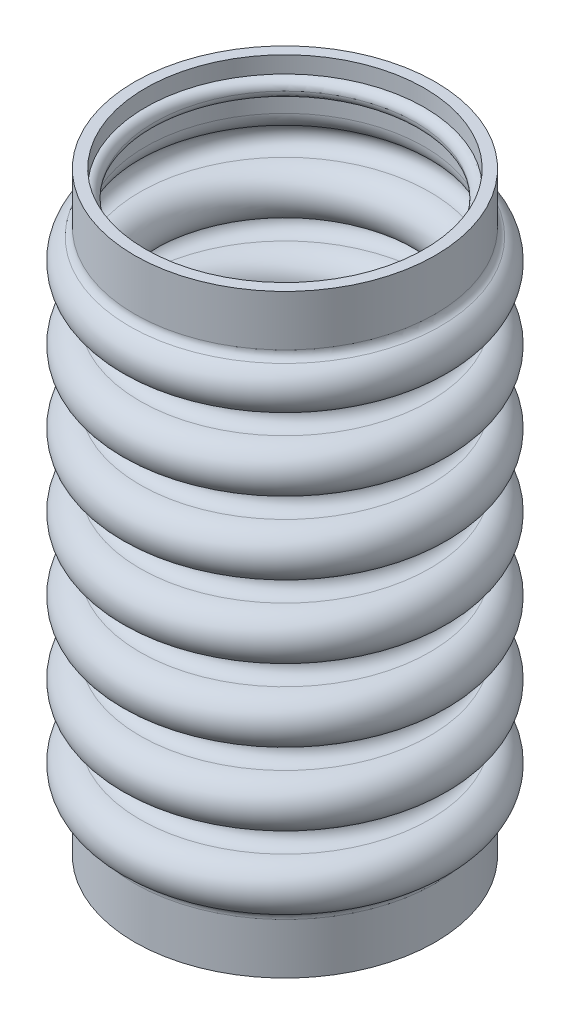
from build123d import *

# Parameters (mm, degrees)
CUT_EXTRUDE1_DEPTH      = 92.141803222
CUT_EXTRUDE1_DEPTH_BACK = 92.141803222
SKETCH3_W               = 41.5
SKETCH3_H               = 1.465119419
SKETCH3_H_2             = 1.466588033
SKETCH4_R               = 19.25
SKETCH4_R_2             = 18.05
BOSS_EXTRUDE2_DEPTH     = 1.2
FILLET2_R               = 1.2
FILLET2_OF_MIRROR3_R    = 1.2


with BuildPart() as part:
    # Sketch1 → Revolve1 (revolve)
    with BuildSketch(Plane.XY, mode=Mode.PRIVATE) as revolve1_sk:
        with BuildLine():
            Line((-20.75, 85), (-20.75, 76.534880581))
            ThreePointArc((-20.75, 76.534880581), (-20.938322032, 75.875077662), (-21.446543826, 75.414083425))
            ThreePointArc((-21.446543826, 75.414083425), (-23.171996107, 71.759160675), (-20.003436298, 69.250002525))
            ThreePointArc((-20.003436298, 69.250002525), (-18.25121849, 67.500521131), (-20.002401893, 65.750004325))
            ThreePointArc((-20.002401893, 65.750004325), (-23.254599463, 62.500739749), (-20.003879614, 59.250001201))
            ThreePointArc((-20.003879614, 59.250001201), (-18.25121857, 57.500741764), (-20.002401893, 55.750003301))
            ThreePointArc((-20.002401893, 55.750003301), (-23.254599463, 52.500738725), (-20.003879614, 49.250000177))
            ThreePointArc((-20.003879614, 49.250000177), (-18.25121857, 47.50074074), (-20.002401893, 45.750002276))
            ThreePointArc((-20.002401893, 45.750002276), (-23.254599463, 42.500737701), (-20.003879614, 39.249999153))
            ThreePointArc((-20.003879614, 39.249999153), (-18.25121857, 37.500739716), (-20.002401893, 35.750001252))
            ThreePointArc((-20.002401893, 35.750001252), (-23.254599463, 32.500736676), (-20.003879614, 29.249998128))
            ThreePointArc((-20.003879614, 29.249998128), (-18.25121857, 27.500738692), (-20.002401893, 25.750000228))
            ThreePointArc((-20.002401893, 25.750000228), (-23.254599463, 22.500735652), (-20.003879614, 19.249997104))
            ThreePointArc((-20.003879614, 19.249997104), (-18.25121857, 17.500737668), (-20.002401893, 15.749999204))
            ThreePointArc((-20.002401893, 15.749999204), (-23.168982395, 13.241064361), (-21.445722161, 9.586979071))
            ThreePointArc((-21.445722161, 9.586979071), (-20.938080206, 9.126001675), (-20.75, 8.466588033))
            Line((-20.75, 8.466588033), (-20.75, 0))
            Line((-20.75, 0), (-19.25, 0))
            Line((-19.25, 0), (-19.25, 8.466588033))
            ThreePointArc((-19.25, 8.466588033), (-19.663776453, 9.917298044), (-20.780588754, 10.931448316))
            ThreePointArc((-20.780588754, 10.931448316), (-21.708498111, 12.899032703), (-20.0034163, 14.249999547))
            ThreePointArc((-20.0034163, 14.249999547), (-16.751218498, 17.500737668), (-20.004894023, 20.749996499))
            ThreePointArc((-20.004894023, 20.749996499), (-21.754599941, 22.500735653), (-20.0034163, 24.250000571))
            ThreePointArc((-20.0034163, 24.250000571), (-16.751218498, 27.500738692), (-20.004894023, 30.749997523))
            ThreePointArc((-20.004894023, 30.749997523), (-21.754599941, 32.500736677), (-20.0034163, 34.250001595))
            ThreePointArc((-20.0034163, 34.250001595), (-16.751218498, 37.500739717), (-20.004894023, 40.749998548))
            ThreePointArc((-20.004894023, 40.749998548), (-21.754599941, 42.500737701), (-20.0034163, 44.250002619))
            ThreePointArc((-20.0034163, 44.250002619), (-16.751218498, 47.500740741), (-20.004894023, 50.749999572))
            ThreePointArc((-20.004894023, 50.749999572), (-21.754599941, 52.500738725), (-20.0034163, 54.250003644))
            ThreePointArc((-20.0034163, 54.250003644), (-16.751218498, 57.500741765), (-20.004894023, 60.750000596))
            ThreePointArc((-20.004894023, 60.750000596), (-21.754599941, 62.50073975), (-20.0034163, 64.250004668))
            ThreePointArc((-20.0034163, 64.250004668), (-16.751218556, 67.500964448), (-20.005337339, 70.75000132))
            ThreePointArc((-20.005337339, 70.75000132), (-21.711487516, 72.101088527), (-20.782396417, 74.069126839))
            ThreePointArc((-20.782396417, 74.069126839), (-19.664308469, 75.08331416), (-19.25, 76.534880581))
            Line((-19.25, 76.534880581), (-19.25, 85))
            Line((-19.25, 85), (-20.75, 85))
        make_face()
    revolve(revolve1_sk.sketch.rotate(Axis((0, 81.830959804, 0), (0, -1, 0)), 270), axis=Axis((0, 81.830959804, 0), (0, -1, 0)))

    # Sketch3 → Cut-Extrude1 (cut, two sides: drawn at the far end of the back side and taken through both)
    with BuildSketch(Plane(origin=(0, 0, 0), x_dir=(0, 0, -1), z_dir=(1, 0, 0)).offset(-CUT_EXTRUDE1_DEPTH_BACK)):
        with Locations((0, 84.267440291)):
            Rectangle(SKETCH3_W, SKETCH3_H)
        with Locations((0, 0.733294017)):
            Rectangle(SKETCH3_W, SKETCH3_H_2)
    extrude(amount=CUT_EXTRUDE1_DEPTH + CUT_EXTRUDE1_DEPTH_BACK, mode=Mode.SUBTRACT)

    # Sketch4 → Boss-Extrude2 (add, symmetric)
    with BuildSketch(Plane(origin=(0, 80.034880581, 0), x_dir=(1, 0, 0), z_dir=(0, 1, 0))):
        with Locations(Location((0, 0, 0), (0, 0, 270))):
            Circle(SKETCH4_R)
        with Locations(Location((0, 0, 0), (0, 0, 270))):
            Circle(SKETCH4_R_2, mode=Mode.SUBTRACT)
    boss_extrude2 = extrude(amount=BOSS_EXTRUDE2_DEPTH, both=True)

    # Fillet2
    fillet2_edges = [part.edges().sort_by_distance(p)[0] for p in [
        (0, 78.834880581, -18.05),
        (0, 81.234880581, -18.05),
    ]]
    fillet(fillet2_edges, radius=FILLET2_R - 0.0001)  # a hair under: the kernel refuses the full size

    # Mirror3: Boss-Extrude2 across plane
    add(boss_extrude2.mirror(Plane.ZX.offset(42.500734307)))

    # Fillet2 of Mirror3
    fillet2_of_mirror3_edges = [part.edges().sort_by_distance(p)[0] for p in [
        (0, 6.166588033, -18.05),
        (0, 3.766588033, -18.05),
    ]]
    fillet(fillet2_of_mirror3_edges, radius=FILLET2_OF_MIRROR3_R - 0.0001)  # a hair under: the kernel refuses the full size


solid = part.part
